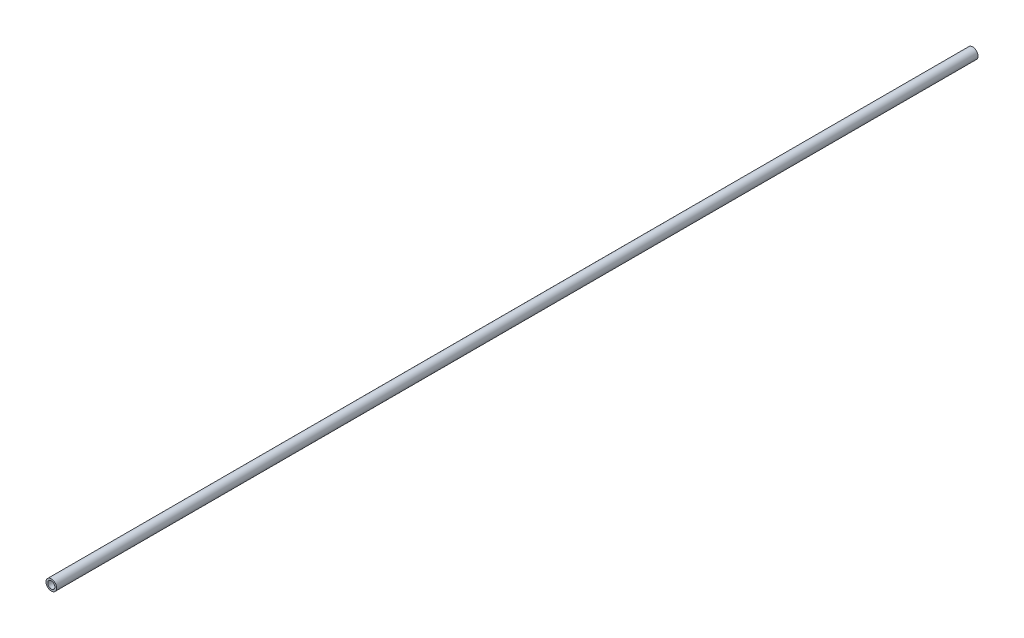
from build123d import *

# Parameters (mm, degrees)
SKETCH1_R           = 4.7625
SKETCH1_R_2         = 3.175
BOSS_EXTRUDE1_DEPTH = 825.5


with BuildPart() as part:
    # Sketch1 → Boss-Extrude1 (new body)
    with BuildSketch(Plane.XY):
        with Locations((-116.372970926, -116.372970926)):
            Circle(SKETCH1_R)
        with Locations((-116.372970926, -116.372970926)):
            Circle(SKETCH1_R_2, mode=Mode.SUBTRACT)
    extrude(amount=BOSS_EXTRUDE1_DEPTH)


solid = part.part
